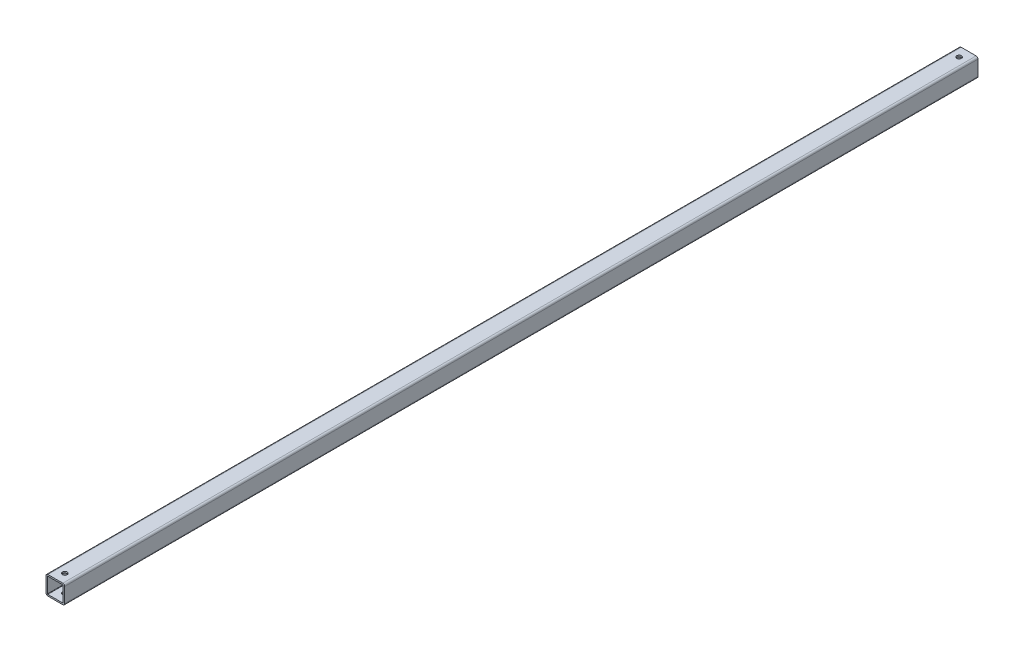
from build123d import *

# Parameters (mm, degrees)
EXTRUDE_THIN1_DEPTH             = 609.6
F_1_4_0_25_DIAMETER_HOLE1_D     = 6.35
F_1_4_0_25_DIAMETER_HOLE1_DEPTH = 27.94
F_1_4_0_25_DIAMETER_HOLE1_TIP   = 1.907732465


with BuildPart() as part:
    # Sketch1 → Extrude-Thin1 (new, symmetric)
    with BuildSketch(Plane.XY):
        with BuildLine():
            Line((-12.5, -10), (-12.5, 10))
            ThreePointArc((-12.5, 10), (-11.767766953, 11.767766953), (-10, 12.5))
            Line((-10, 12.5), (10, 12.5))
            ThreePointArc((10, 12.5), (11.767766953, 11.767766953), (12.5, 10))
            Line((12.5, 10), (12.5, -10))
            ThreePointArc((12.5, -10), (11.767766953, -11.767766953), (10, -12.5))
            Line((10, -12.5), (-10, -12.5))
            ThreePointArc((-10, -12.5), (-11.767766953, -11.767766953), (-12.5, -10))
        make_face()
        with BuildLine():
            Line((-10.5, -10), (-10.5, 10))
            ThreePointArc((-10.5, 10), (-10.353553391, 10.353553391), (-10, 10.5))
            Line((-10, 10.5), (10, 10.5))
            ThreePointArc((10, 10.5), (10.353553391, 10.353553391), (10.5, 10))
            Line((10.5, 10), (10.5, -10))
            ThreePointArc((10.5, -10), (10.353553391, -10.353553391), (10, -10.5))
            Line((10, -10.5), (-10, -10.5))
            ThreePointArc((-10, -10.5), (-10.353553391, -10.353553391), (-10.5, -10))
        make_face(mode=Mode.SUBTRACT)
    extrude(amount=EXTRUDE_THIN1_DEPTH, both=True)

    # 1/4 (0.25) Diameter Hole1
    with Locations(Plane(origin=(0, 12.5, 0), x_dir=(1, 0, 0), z_dir=(0, 1, 0))):
        with Locations((0, 596.9), (0, -596.9)):
            Hole(F_1_4_0_25_DIAMETER_HOLE1_D / 2, depth=F_1_4_0_25_DIAMETER_HOLE1_DEPTH)
            with Locations((0, 0, -(F_1_4_0_25_DIAMETER_HOLE1_DEPTH + F_1_4_0_25_DIAMETER_HOLE1_TIP / 2))):  # 118° drill point
                Cone(0, F_1_4_0_25_DIAMETER_HOLE1_D / 2, F_1_4_0_25_DIAMETER_HOLE1_TIP, mode=Mode.SUBTRACT)


solid = part.part
